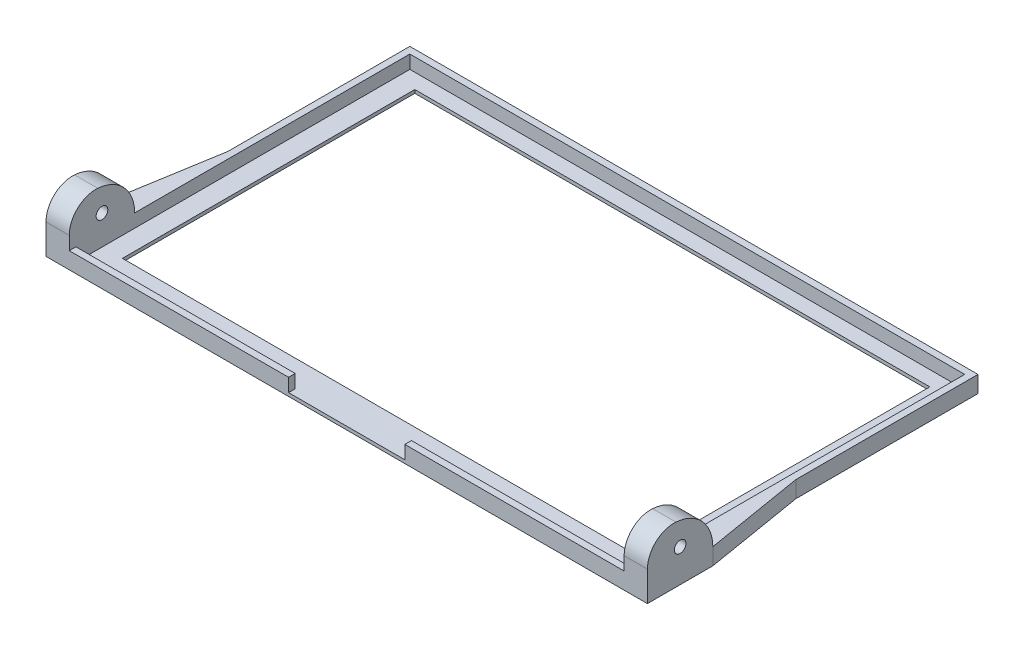
from build123d import *

# Parameters (mm, degrees)
SKETCH1_W                = 171
SKETCH1_H                = 104.5
SKETCH1_W_2              = 155
SKETCH1_H_2              = 88
BOSS_EXTRUDE1_DEPTH      = 1
SKETCH2_W                = 171
SKETCH2_H                = 104.5
SKETCH2_W_2              = 167
SKETCH2_H_2              = 100.5
BOSS_EXTRUDE2_DEPTH      = 4
SKETCH3_W                = 35
SKETCH3_H                = 8.699372258
CUT_EXTRUDE1_DEPTH       = 14
BOSS_EXTRUDE3_DEPTH      = 16
BOSS_EXTRUDE3_DEPTH_BACK = 1
SKETCH4_W                = 7
SKETCH4_H                = 19.695550369
FILLET1_R                = 12
CHAMFER1_SIZE            = 30
CHAMFER1_SIZE_2          = 5
FILLET2_R                = 8
SKETCH5_R                = 1.75
CUT_EXTRUDE2_DEPTH       = 216


with BuildPart() as part:
    # Sketch1 → Boss-Extrude1 (new body)
    with BuildSketch(Plane(origin=(0, 0, 0), x_dir=(1, 0, 0), z_dir=(0, 1, 0))):
        with Locations((0, -1.75)):
            Rectangle(SKETCH1_W, SKETCH1_H)
        Rectangle(SKETCH1_W_2, SKETCH1_H_2, mode=Mode.SUBTRACT)
    extrude(amount=BOSS_EXTRUDE1_DEPTH)

    # Sketch2 → Boss-Extrude2 (add)
    with BuildSketch(Plane(origin=(0, 1, 0), x_dir=(1, 0, 0), z_dir=(0, 1, 0))):
        with Locations((0, -1.75)):
            Rectangle(SKETCH2_W, SKETCH2_H)
        with Locations((0, -1.75)):
            Rectangle(SKETCH2_W_2, SKETCH2_H_2, mode=Mode.SUBTRACT)
    extrude(amount=BOSS_EXTRUDE2_DEPTH)

    # Sketch3 → Cut-Extrude1 (cut)
    with BuildSketch(Plane(origin=(0, 1, 0), x_dir=(1, 0, 0), z_dir=(0, 1, 0))):
        with Locations((0, -52)):
            Rectangle(SKETCH3_W, SKETCH3_H)
    extrude(amount=CUT_EXTRUDE1_DEPTH, mode=Mode.SUBTRACT)

    # Sketch4 → Boss-Extrude3 (add, two sides: drawn at the far end of the back side and taken through both)
    with BuildSketch(Plane(origin=(0, 1, 0), x_dir=(1, 0, 0), z_dir=(0, 1, 0)).offset(-BOSS_EXTRUDE3_DEPTH_BACK)):
        with Locations((-87, -44.152224816)):
            Rectangle(SKETCH4_W, SKETCH4_H)
        with Locations((87, -44.152224816)):
            Rectangle(SKETCH4_W, SKETCH4_H)
    extrude(amount=BOSS_EXTRUDE3_DEPTH + BOSS_EXTRUDE3_DEPTH_BACK)

    # Fillet1
    fillet1_edges = [part.edges().sort_by_distance(p)[0] for p in [
        (87, 17, 34.304449631),
        (-87, 17, 34.304449631),
    ]]
    fillet(fillet1_edges, radius=FILLET1_R)

    # Chamfer1
    # the kernel refuses this chamfer: 30, 5 mm, written as the material it adds along each edge
    with BuildSketch(Plane(origin=(85.5, 5, 34.304449631), x_dir=(-0.006326222023777661, 0, -0.999979989257238), z_dir=(0, -1, 0))) as chamfer1_piece_1_section:
        Polygon((CHAMFER1_SIZE * 0.999979989257, CHAMFER1_SIZE * 0.00632622202378), (-CHAMFER1_SIZE_2 * 0.00632622202378, CHAMFER1_SIZE_2 * 0.999979989257), (0, 0), align=None)
    chamfer1_piece_1 = extrude(amount=5, mode=Mode.PRIVATE)
    chamfer1_piece_1 = split(chamfer1_piece_1, bisect_by=Plane(origin=(90.5, 2.5, 23.467018092), z_dir=(-1, 0, 0)), keep=Keep.TOP, mode=Mode.PRIVATE)
    add(chamfer1_piece_1)
    with BuildSketch(Plane(origin=(-85.5, 0, 34.304449631), x_dir=(0.006326222023777661, 0, -0.999979989257238), z_dir=(0, 1, 0))) as chamfer1_piece_2_section:
        Polygon((CHAMFER1_SIZE * 0.999979989257, CHAMFER1_SIZE * 0.00632622202378), (-CHAMFER1_SIZE_2 * 0.00632622202378, CHAMFER1_SIZE_2 * 0.999979989257), (0, 0), align=None)
    chamfer1_piece_2 = extrude(amount=5, mode=Mode.PRIVATE)
    chamfer1_piece_2 = split(chamfer1_piece_2, bisect_by=Plane(origin=(-90.5, 2.5, 23.467018092), z_dir=(1, 0, 0)), keep=Keep.TOP, mode=Mode.PRIVATE)
    add(chamfer1_piece_2)

    # Fillet2
    fillet2_edges = [part.edges().sort_by_distance(p)[0] for p in [
        (87, 17, 54),
        (-87, 17, 54),
    ]]
    fillet(fillet2_edges, radius=FILLET2_R)

    # Sketch5 → Cut-Extrude2 (cut)
    with BuildSketch(Plane.ZY.offset(90.5)):
        with Locations((44.152224816, 9.892685603)):
            Circle(SKETCH5_R)
    extrude(amount=-CUT_EXTRUDE2_DEPTH, mode=Mode.SUBTRACT)


solid = part.part
